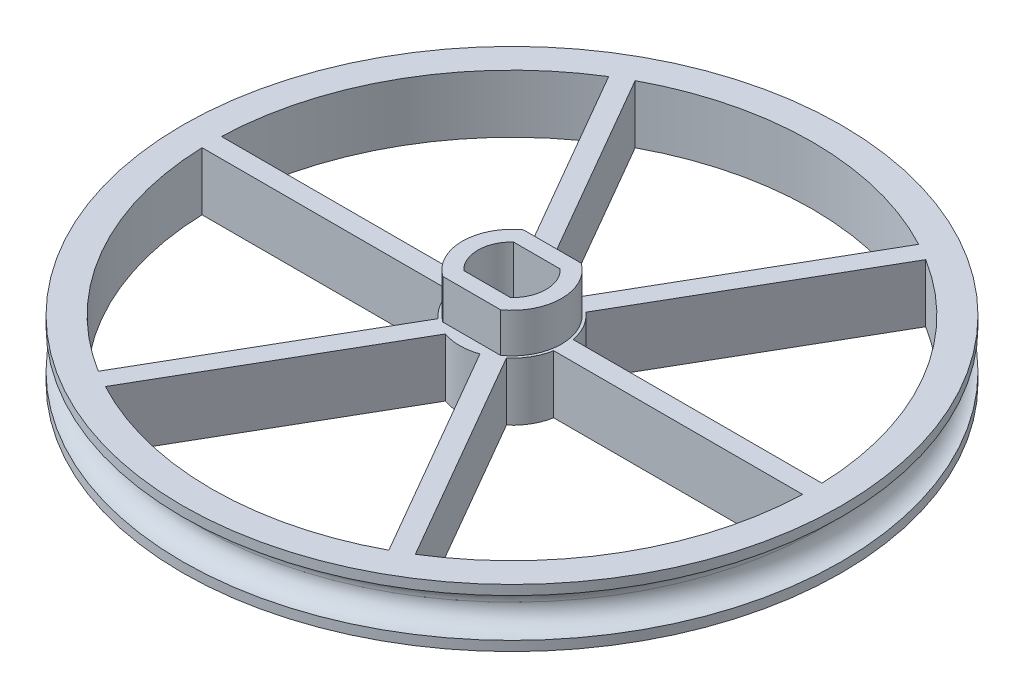
from build123d import *

# Parameters (mm, degrees)
INNERWHEEL_START                            = -0.79375
INNERWHEEL_OUTLINE_R                        = 4.28625
INNERWHEEL_DEPTH                            = 4.7625
CONNECTIONINNEROUTER_REACH                  = 43.498
CONNECTIONINNEROUTER_END_RADIUS             = 24.60625
SKETCH3_W                                   = 1.5875
SKETCH3_H                                   = 4.7625
CONNECTIONINNEROUTER_DIRECTION_2_REACH      = 43.498
CONNECTIONINNEROUTER_DIRECTION_2_END_RADIUS = 4.28625
CIRCULARPATTERN_COUNT                       = 6
MOTORSUPPORTEXTRUDE_DEPTH                   = 8
MOTORSUPPORTCUT_START                       = -8
MOTORSUPPORTCUT_DEPTH                       = 8
TIREFILLET_R                                = 1.5875


# Read off the part's stored shape, not the designer's step: InnerWheel
with BuildPart() as part:
    # OuterWheelSketch → OuterWheel (revolve)
    with BuildSketch(Plane.XY, mode=Mode.PRIVATE) as outerwheel_sk:
        Polygon((-25.4, 0), (-26.9875, 0), (-26.9875, -0.79375), (-24.60625, -0.79375), (-24.60625, 3.96875), (-26.9875, 3.96875), (-26.9875, 3.175), (-25.4, 3.175), align=None)
    revolve(outerwheel_sk.sketch.rotate(Axis((0, -1.962659061, 0), (0, 1, 0)), 270), axis=Axis((0, -1.962659061, 0), (0, 1, 0)))



with BuildPart() as body_2:
    # InnerWheel outline → InnerWheel (new body)
    with BuildSketch(Plane(origin=(0, 0, 0), x_dir=(1, 0, 0), z_dir=(0, 1, 0)).offset(INNERWHEEL_START)):
        Circle(INNERWHEEL_OUTLINE_R)
    extrude(amount=INNERWHEEL_DEPTH)


with BuildPart() as part_1:
    add(part.part)

    add(body_2.part)  # ConnectionInnerOuter merges body 2
    # ConnectionInnerOuter: up to this cylinder (the profile starts inside it)
    connectioninnerouter_end = Plane(origin=(0, 1.5875, 0), z_dir=(0, -1, 0)) * Cylinder(CONNECTIONINNEROUTER_END_RADIUS, 137.2085, mode=Mode.PRIVATE)
    # Sketch3 → ConnectionInnerOuter (add, up to the surface)
    with BuildSketch(Plane(origin=(4.28625, 0, 0), x_dir=(0, 0, -1), z_dir=(1, 0, 0)), mode=Mode.PRIVATE) as connectioninnerouter_sk1:
        with Locations((0, 1.5875)):
            Rectangle(SKETCH3_W, SKETCH3_H)
    connectioninnerouter_tool1 = extrude(connectioninnerouter_sk1.sketch, amount=CONNECTIONINNEROUTER_REACH, mode=Mode.PRIVATE) & connectioninnerouter_end
    connectioninnerouter = connectioninnerouter_tool1.solids().sort_by_distance((4.28625, 1.5875, 0))[0]
    add(connectioninnerouter)

    # ConnectionInnerOuter direction 2: up to this cylinder (the profile starts outside it)
    connectioninnerouter_direction_2_end = Plane(origin=(0, 1.5875, 0), z_dir=(0, -1, 0)) * Cylinder(CONNECTIONINNEROUTER_DIRECTION_2_END_RADIUS, 96.5685, mode=Mode.PRIVATE)
    # Sketch3 → ConnectionInnerOuter direction 2 (add, up to the surface)
    with BuildSketch(Plane(origin=(4.28625, 0, 0), x_dir=(0, 0, -1), z_dir=(1, 0, 0)), mode=Mode.PRIVATE) as connectioninnerouter_direction_2_sk1:
        with Locations((0, 1.5875)):
            Rectangle(SKETCH3_W, SKETCH3_H)
    connectioninnerouter_direction_2_tool1 = extrude(connectioninnerouter_direction_2_sk1.sketch, amount=-CONNECTIONINNEROUTER_DIRECTION_2_REACH, mode=Mode.PRIVATE) - connectioninnerouter_direction_2_end
    connectioninnerouter_direction_2 = connectioninnerouter_direction_2_tool1.solids().sort_by_distance((4.28625, 1.5875, 0))[0] + connectioninnerouter_direction_2_tool1.solids().sort_by_distance((4.28625, 1.5875, 0))[1]
    add(connectioninnerouter_direction_2)
    connectioninnerouter = connectioninnerouter + connectioninnerouter_direction_2  # both directions under the feature's name, for the pattern or mirror that repeats it

    # CircularPattern: ConnectionInnerOuter ×6 about axis
    circularpattern_axis = Axis((0, 0, 0), (0, 1, 0))
    for i in range(1, CIRCULARPATTERN_COUNT):
        add(connectioninnerouter.rotate(circularpattern_axis, i * 360 / CIRCULARPATTERN_COUNT))

    # OuterMottorSupport → MotorSupportExtrude (add)
    with BuildSketch(Plane(origin=(0, -0.79375, 0), x_dir=(-1, 0, 0), z_dir=(0, -1, 0))):
        with BuildLine():
            Line((-2.369154279, -3.302), (2.369154279, -3.302))
            ThreePointArc((2.369154279, -3.302), (4.064, 0), (2.369154279, 3.302))
            Line((2.369154279, 3.302), (-2.369154279, 3.302))
            ThreePointArc((-2.369154279, 3.302), (-4.064, 0), (-2.369154279, -3.302))
        make_face()
    extrude(amount=-MOTORSUPPORTEXTRUDE_DEPTH)

    # InnerMotorSupport → MotorSupportCut (cut)
    with BuildSketch(Plane(origin=(0, -0.79375, 0), x_dir=(-1, 0, 0), z_dir=(0, -1, 0)).offset(MOTORSUPPORTCUT_START)):
        with BuildLine():
            Line((-1.917657947, 2.032), (1.917657947, 2.032))
            ThreePointArc((1.917657947, 2.032), (2.794, 0), (1.917657947, -2.032))
            Line((1.917657947, -2.032), (-1.917657947, -2.032))
            ThreePointArc((-1.917657947, -2.032), (-2.794, 0), (-1.917657947, 2.032))
        make_face()
    extrude(amount=MOTORSUPPORTCUT_DEPTH, mode=Mode.SUBTRACT)

    # TireFillet
    tirefillet_edges = [part_1.edges().sort_by_distance(p)[0] for p in [
        (0, 0, 25.4),
        (0, 3.175, 25.4),
    ]]
    fillet(tirefillet_edges, radius=TIREFILLET_R - 0.0001)  # a hair under: the kernel refuses the full size


solid = part_1.part
